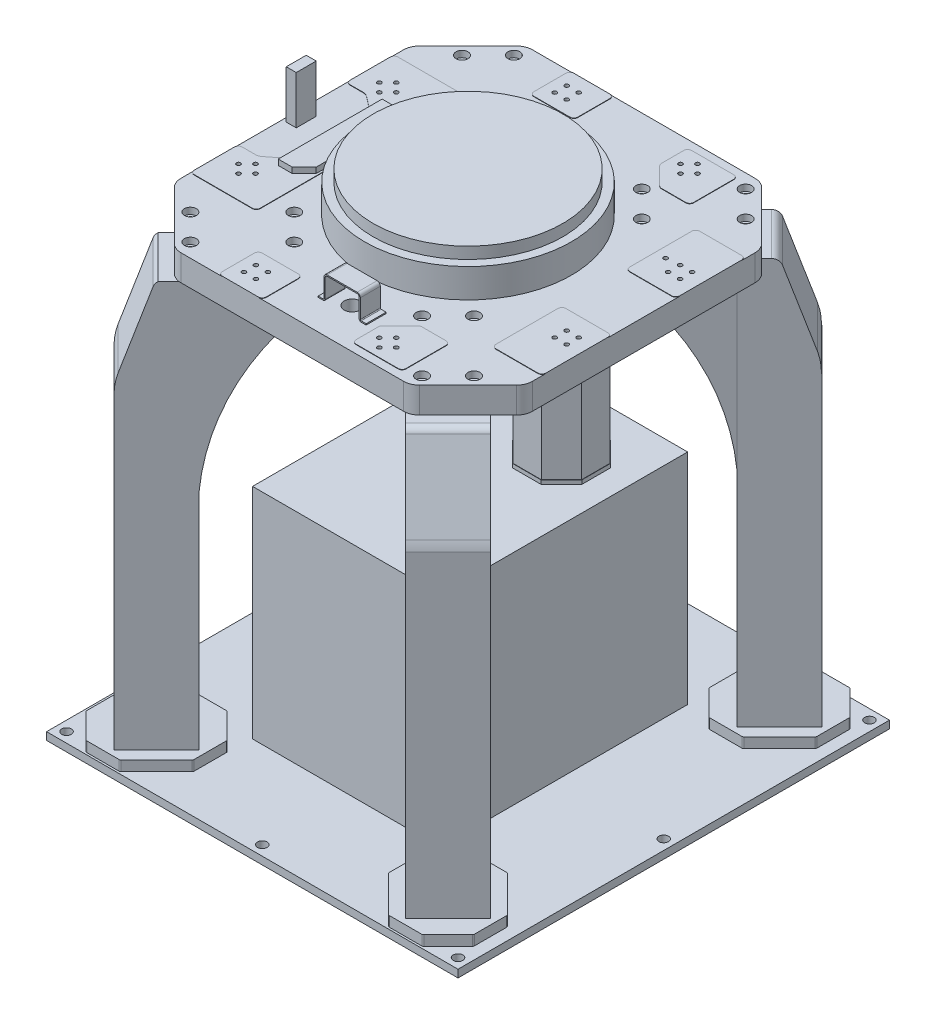
from build123d import *
from OCP.BRepAlgoAPI import BRepAlgoAPI_Cut
from OCP.TopTools import TopTools_ListOfShape

# Parameters (mm, degrees)
SKETCH4_W                                            = 1030
SKETCH4_H                                            = 1080
BASE_EXTRUDE_DEPTH                                   = 19.05
BOSS_EXTRUDE1_DEPTH                                  = 25.4
BOSS_EXTRUDE2_DEPTH                                  = 1016
BOSS_EXTRUDE3_DEPTH                                  = 177.8
BOSS_EXTRUDE3_DEPTH_BACK                             = 76.2
SKETCH9_W                                            = 150.000007
SKETCH9_H                                            = 457.2
BOSS_EXTRUDE4_DEPTH                                  = 177.8
BOSS_EXTRUDE4_DEPTH_BACK                             = 76.2
SKETCH12_W                                           = 150.000007
SKETCH12_H                                           = 457.2
CUT_EXTRUDE1_REACH                                   = 1365.161
CUT_EXTRUDE2_START                                   = -150.000004
CUT_EXTRUDE2_DEPTH                                   = 150.000006
BOSS_EXTRUDE5_DEPTH                                  = 177.8
BOSS_EXTRUDE5_DEPTH_BACK                             = 76.2
SKETCH14_W                                           = 150.000007
SKETCH14_H                                           = 457.2
BOSS_EXTRUDE6_DEPTH                                  = 177.8
BOSS_EXTRUDE6_DEPTH_BACK                             = 76.2
SKETCH15_W                                           = 150.000007
SKETCH15_H                                           = 457.2
CUT_EXTRUDE3_DEPTH                                   = 177.8
CUT_EXTRUDE4_START                                   = -150.000004
CUT_EXTRUDE4_DEPTH                                   = 150.000006
BOSS_EXTRUDE7_DEPTH                                  = 65.024
SKETCH19_W                                           = 469.9
SKETCH19_H                                           = 619.178727
BOSS_EXTRUDE8_DEPTH                                  = 547.624
BOSS_EXTRUDE9_DEPTH                                  = 90.5
BOSS_EXTRUDE10_DEPTH                                 = 239.395
EXTRUDE1_DEPTH                                       = 11.5
BOSS_EXTRUDE11_DEPTH                                 = 9.7155
EXTRUDE2_DEPTH                                       = 9.365
EXTRUDE3_DEPTH                                       = 21.7475
EXTRUDE3_TAPER                                       = 1
SKETCH23_R                                           = 258.980392
BOSS_EXTRUDE12_DEPTH                                 = 72.5
SKETCH24_R                                           = 237.5
BOSS_EXTRUDE13_DEPTH                                 = 29
M24_0_24_000000_DIAMETER_HOLE1_D                     = 24
LPATTERN1_COUNT                                      = 3
LPATTERN1_PITCH                                      = 515
LPATTERN1_COUNT_DIR2                                 = 3
LPATTERN1_PITCH_DIR2                                 = 490
M16_FORO_LAMATO_PER_VITE_A_TESTA_ESAGONA_D           = 17.5
M16_FORO_LAMATO_PER_VITE_A_TESTA_ESAGONA_DEPTH       = 65.024
M16_FORO_LAMATO_PER_VITE_A_TESTA_ESAGONA_CBORE_D     = 30
M16_FORO_LAMATO_PER_VITE_A_TESTA_ESAGONA_CBORE_DEPTH = 16
SCHIZZO10_W                                          = 200
SCHIZZO10_H                                          = 140
ESTRUSIONE1_DEPTH                                    = 170
SCHIZZO11_R                                          = 20
TAGLIO_ESTRUSIONE4_DEPTH                             = 65.024
ESTRUSIONE2_DEPTH                                    = 1
M12_FORO_FILETTATO_PROFONDO1_D                       = 10.2
M12_FORO_FILETTATO_PROFONDO1_DEPTH                   = 66.024
SCHIZZO19_W                                          = 25
SCHIZZO19_H                                          = 50
ESTRUSIONE3_DEPTH                                    = 120
ESTRUSIONE4_DEPTH                                    = 15
ESTRUSIONE4_DEPTH_BACK                               = 5
ESTRUSIONE_SOTTILE1_START                            = -125
ESTRUSIONE_SOTTILE1_DEPTH                            = 50
SCHIZZO23_W                                          = 100
SCHIZZO23_H                                          = 100
ESTRUSIONE5_DEPTH                                    = 10
SMUSSO1_SIZE                                         = 5


with BuildPart() as part:
    # Sketch4 → Base-Extrude (new body)
    with BuildSketch(Plane(origin=(0, 0, 0), x_dir=(1, 0, 0), z_dir=(0, 1, 0))):
        Rectangle(SKETCH4_W, SKETCH4_H)
    extrude(amount=BASE_EXTRUDE_DEPTH)

    # Sketch5 → Boss-Extrude1 (add)
    with BuildSketch(Plane(origin=(0, 19.05, 0), x_dir=(-1, 0, 0), z_dir=(0, 1, 0))):
        with BuildLine():
            Line((335.019684, -533.512103), (246.104734, -444.597152))
            ThreePointArc((246.104734, -444.597152), (245.003528, -442.949082), (244.616836, -441.00505))
            Line((244.616836, -441.00505), (244.61684, -360.360649))
            ThreePointArc((244.61684, -360.360649), (245.003532, -358.416617), (246.104737, -356.768546))
            Line((246.104737, -356.768546), (306.76855, -296.104734))
            ThreePointArc((306.76855, -296.104734), (308.416621, -295.003528), (310.360652, -294.616836))
            Line((310.360652, -294.616836), (391.00506, -294.616836))
            ThreePointArc((391.00506, -294.616836), (392.949091, -295.003528), (394.597163, -296.10473))
            Line((394.597163, -296.10473), (483.512103, -385.019674))
            ThreePointArc((483.512103, -385.019674), (484.613309, -386.667745), (485.000001, -388.611777))
            Line((485.000001, -388.611777), (485.000001, -469.256184))
            ThreePointArc((485.000001, -469.256184), (484.613309, -471.200216), (483.512103, -472.848287))
            Line((483.512103, -472.848287), (422.84829, -533.5121))
            ThreePointArc((422.84829, -533.5121), (421.20022, -534.613305), (419.256188, -534.999997))
            Line((419.256188, -534.999997), (338.611787, -535.000001))
            ThreePointArc((338.611787, -535.000001), (336.667755, -534.613309), (335.019684, -533.512103))
        make_face()
        with BuildLine():
            Line((-244.616836, -441.00505), (-244.61684, -360.360649))
            ThreePointArc((-244.61684, -360.360649), (-245.003532, -358.416617), (-246.104737, -356.768546))
            Line((-246.104737, -356.768546), (-306.76855, -296.104734))
            ThreePointArc((-306.76855, -296.104734), (-308.416621, -295.003528), (-310.360652, -294.616836))
            Line((-310.360652, -294.616836), (-391.00506, -294.616836))
            ThreePointArc((-391.00506, -294.616836), (-392.949091, -295.003528), (-394.597163, -296.10473))
            Line((-394.597163, -296.10473), (-483.512103, -385.019674))
            ThreePointArc((-483.512103, -385.019674), (-484.613309, -386.667745), (-485.000001, -388.611777))
            Line((-485.000001, -388.611777), (-485.000001, -469.256184))
            ThreePointArc((-485.000001, -469.256184), (-484.613309, -471.200216), (-483.512103, -472.848287))
            Line((-483.512103, -472.848287), (-422.84829, -533.5121))
            ThreePointArc((-422.84829, -533.5121), (-421.20022, -534.613305), (-419.256188, -534.999997))
            Line((-419.256188, -534.999997), (-338.611787, -535.000001))
            ThreePointArc((-338.611787, -535.000001), (-336.667755, -534.613309), (-335.019684, -533.512103))
            Line((-335.019684, -533.512103), (-246.104734, -444.597152))
            ThreePointArc((-246.104734, -444.597152), (-245.003528, -442.949082), (-244.616836, -441.00505))
        make_face()
        with BuildLine():
            Line((244.616836, 441.00505), (244.61684, 360.360649))
            ThreePointArc((244.61684, 360.360649), (245.003532, 358.416617), (246.104737, 356.768546))
            Line((246.104737, 356.768546), (306.76855, 296.104734))
            ThreePointArc((306.76855, 296.104734), (308.416621, 295.003528), (310.360652, 294.616836))
            Line((310.360652, 294.616836), (391.00506, 294.616836))
            ThreePointArc((391.00506, 294.616836), (392.949091, 295.003528), (394.597163, 296.10473))
            Line((394.597163, 296.10473), (483.512103, 385.019674))
            ThreePointArc((483.512103, 385.019674), (484.613309, 386.667745), (485.000001, 388.611777))
            Line((485.000001, 388.611777), (485.000001, 469.256184))
            ThreePointArc((485.000001, 469.256184), (484.613309, 471.200216), (483.512103, 472.848287))
            Line((483.512103, 472.848287), (422.84829, 533.5121))
            ThreePointArc((422.84829, 533.5121), (421.20022, 534.613305), (419.256188, 534.999997))
            Line((419.256188, 534.999997), (338.611787, 535.000001))
            ThreePointArc((338.611787, 535.000001), (336.667755, 534.613309), (335.019684, 533.512103))
            Line((335.019684, 533.512103), (246.104734, 444.597152))
            ThreePointArc((246.104734, 444.597152), (245.003528, 442.949082), (244.616836, 441.00505))
        make_face()
        with BuildLine():
            Line((-335.019684, 533.512103), (-246.104734, 444.597152))
            ThreePointArc((-246.104734, 444.597152), (-245.003528, 442.949082), (-244.616836, 441.00505))
            Line((-244.616836, 441.00505), (-244.61684, 360.360649))
            ThreePointArc((-244.61684, 360.360649), (-245.003532, 358.416617), (-246.104737, 356.768546))
            Line((-246.104737, 356.768546), (-306.76855, 296.104734))
            ThreePointArc((-306.76855, 296.104734), (-308.416621, 295.003528), (-310.360652, 294.616836))
            Line((-310.360652, 294.616836), (-391.00506, 294.616836))
            ThreePointArc((-391.00506, 294.616836), (-392.949091, 295.003528), (-394.597163, 296.10473))
            Line((-394.597163, 296.10473), (-483.512103, 385.019674))
            ThreePointArc((-483.512103, 385.019674), (-484.613309, 386.667745), (-485.000001, 388.611777))
            Line((-485.000001, 388.611777), (-485.000001, 469.256184))
            ThreePointArc((-485.000001, 469.256184), (-484.613309, 471.200216), (-483.512103, 472.848287))
            Line((-483.512103, 472.848287), (-422.84829, 533.5121))
            ThreePointArc((-422.84829, 533.5121), (-421.20022, 534.613305), (-419.256188, 534.999997))
            Line((-419.256188, 534.999997), (-338.611787, 535.000001))
            ThreePointArc((-338.611787, 535.000001), (-336.667755, 534.613309), (-335.019684, 533.512103))
        make_face()
    extrude(amount=BOSS_EXTRUDE1_DEPTH)

    # Sketch6 → Boss-Extrude2 (add)
    with BuildSketch(Plane(origin=(0, 44.45, 0), x_dir=(-1, 0, 0), z_dir=(0, 1, 0))):
        Polygon((364.791864, 520.85787), (470.857868, 414.791848), (364.792063, 308.726043), (258.72605, 414.792074), align=None)
        Polygon((258.72605, -414.792074), (364.792063, -308.726043), (470.857868, -414.791848), (364.791864, -520.85787), align=None)
        Polygon((-364.791864, -520.85787), (-470.857868, -414.791848), (-364.792063, -308.726043), (-258.72605, -414.792074), align=None)
        Polygon((-258.72605, 414.792074), (-364.792063, 308.726043), (-470.857868, 414.791848), (-364.791864, 520.85787), align=None)
    extrude(amount=BOSS_EXTRUDE2_DEPTH)

    # Sketch9 → Boss-Extrude3 (add, two sides: drawn at the far end of the back side and taken through both)
    with BuildSketch(Plane(origin=(-336.759084, 0, 336.759027), x_dir=(-0.7071067222412493, 0, -0.707106840131841), z_dir=(0.707106840131841, 0, -0.7071067222412493)).offset(-BOSS_EXTRUDE3_DEPTH_BACK)):
        with Locations((-35.355381, 831.85)):
            Rectangle(SKETCH9_W, SKETCH9_H)
    extrude(amount=BOSS_EXTRUDE3_DEPTH + BOSS_EXTRUDE3_DEPTH_BACK)

    # Sketch12 → Boss-Extrude4 (add, two sides: drawn at the far end of the back side and taken through both)
    with BuildSketch(Plane(origin=(-336.759084, 0, -336.759027), x_dir=(0.7071067222412493, 0, -0.707106840131841), z_dir=(0.707106840131841, 0, 0.7071067222412493)).offset(-BOSS_EXTRUDE4_DEPTH_BACK)):
        with Locations((35.355381, 831.85)):
            Rectangle(SKETCH12_W, SKETCH12_H)
    extrude(amount=BOSS_EXTRUDE4_DEPTH + BOSS_EXTRUDE4_DEPTH_BACK)

    # Sketch11 → Cut-Extrude1 (cut, up to next)
    with BuildSketch(Plane(origin=(78.033034, 0, 78.033047), x_dir=(0.7071068401318419, 0, -0.7071067222412484), z_dir=(0.7071067222412484, 0, 0.7071068401318419)), mode=Mode.PRIVATE) as cut_extrude1_sk1:
        with BuildLine():
            Line((-476.249224, 603.070662), (-476.249224, 537.249112))
            Line((-476.249224, 537.249112), (-191.197117, 537.249112))
            Line((-191.197117, 537.249112), (-191.197117, 1012.381678))
            Line((-191.197117, 1012.381678), (-297.66446, 1012.381678))
            ThreePointArc((-297.66446, 1012.381678), (-299.934967, 994.691688), (-309.233278, 979.472215))
            ThreePointArc((-309.233278, 979.472215), (-425.163771, 805.657877), (-476.249224, 603.070662))
        make_face()
    cut_extrude1_tool1 = extrude(cut_extrude1_sk1.sketch, amount=-CUT_EXTRUDE1_REACH, mode=Mode.PRIVATE) & part.part
    # Sketch11 → Cut-Extrude1 (cut, up to next)
    with BuildSketch(Plane(origin=(78.033034, 0, 78.033047), x_dir=(0.7071068401318419, 0, -0.7071067222412484), z_dir=(0.7071067222412484, 0, 0.7071068401318419)), mode=Mode.PRIVATE) as cut_extrude1_sk2:
        with BuildLine():
            Line((-619.187248, 862.834274), (-557.397589, 1049.461065))
            ThreePointArc((-557.397589, 1049.461065), (-550.244945, 1059.219873), (-538.732571, 1062.942761))
            Line((-538.732571, 1062.942761), (-533.613663, 1077.567942))
            Line((-533.613663, 1077.567942), (-868.111305, 1077.567942))
            Line((-868.111305, 1077.567942), (-868.111305, 812.900685))
            Line((-868.111305, 812.900685), (-626.248924, 812.900685))
            ThreePointArc((-626.248924, 812.900685), (-624.961589, 838.184759), (-619.187248, 862.834274))
        make_face()
    cut_extrude1_tool2 = extrude(cut_extrude1_sk2.sketch, amount=-CUT_EXTRUDE1_REACH, mode=Mode.PRIVATE) & part.part
    add(cut_extrude1_tool1.solids().sort_by_distance((-142.622671, 741.960708, 298.688714))[0], mode=Mode.SUBTRACT)
    add(cut_extrude1_tool2.solids().sort_by_distance((-436.749289, 952.347173, 592.815283))[0], mode=Mode.SUBTRACT)


with BuildPart() as cut_extrude2_tool:
    # Cut-Extrude2: read off the stored shape, not the designer's step
    # Cut-Extrude2 outline → Cut-Extrude2 (new body)
    with BuildSketch(Plane(origin=(-350.833008, 257.130059, -294.766994), x_dir=(0.707106840131841, 0, 0.7071067222412493), z_dir=(-0.7071067222412493, 0, 0.707106840131841)).offset(CUT_EXTRUDE2_START)):
        with BuildLine():
            ThreePointArc((158.058919, 743.784433), (154.085193, 732.782128), (147.274865, 723.271048))
            ThreePointArc((147.274865, 723.271048), (31.344372, 549.456711), (-19.741081, 346.869496))
            Line((-19.741081, 346.869496), (-19.741081, 346.119941))
            Line((-19.741081, 346.119941), (158.058919, 346.119941))
            Line((158.058919, 346.119941), (158.058919, 743.784433))
        make_face()
        with BuildLine():
            ThreePointArc((-100.623705, 793.259899), (-97.660377, 798.913544), (-93.042077, 803.319941))
            Line((-93.042077, 803.319941), (-169.740781, 803.319941))
            Line((-169.740781, 803.319941), (-169.740781, 556.699518))
            Line((-169.740781, 556.699518), (-169.47504, 556.699518))
            ThreePointArc((-169.47504, 556.699518), (-168.187706, 581.983592), (-162.413364, 606.633108))
            Line((-162.413364, 606.633108), (-100.623705, 793.259899))
        make_face()
    extrude(amount=CUT_EXTRUDE2_DEPTH)


with BuildPart() as part_1:
    add(part.part)

    # Cut-Extrude2: cut by cut_extrude2_tool, with a tolerance
    cut_extrude2_stock = TopTools_ListOfShape()
    cut_extrude2_stock.Append(part_1.part.wrapped)
    cut_extrude2_tools = TopTools_ListOfShape()
    cut_extrude2_tools.Append(cut_extrude2_tool.part.wrapped)
    cut_extrude2_cut = BRepAlgoAPI_Cut()
    cut_extrude2_cut.SetArguments(cut_extrude2_stock)
    cut_extrude2_cut.SetTools(cut_extrude2_tools)
    cut_extrude2_cut.SetFuzzyValue(0.00001)
    cut_extrude2_cut.Build()
    add(Compound.cast(cut_extrude2_cut.Shape()).solids(), mode=Mode.REPLACE)

    # Sketch14 → Boss-Extrude5 (add, two sides: drawn at the far end of the back side and taken through both)
    with BuildSketch(Plane(origin=(336.759084, 0, -336.759027), x_dir=(0.7071067222412493, 0, 0.707106840131841), z_dir=(-0.707106840131841, 0, 0.7071067222412493)).offset(-BOSS_EXTRUDE5_DEPTH_BACK)):
        with Locations((-35.355381, 831.85)):
            Rectangle(SKETCH14_W, SKETCH14_H)
    extrude(amount=BOSS_EXTRUDE5_DEPTH + BOSS_EXTRUDE5_DEPTH_BACK)

    # Sketch15 → Boss-Extrude6 (add, two sides: drawn at the far end of the back side and taken through both)
    with BuildSketch(Plane(origin=(336.759084, 0, 336.759027), x_dir=(-0.7071067222412493, 0, 0.707106840131841), z_dir=(-0.707106840131841, 0, -0.7071067222412493)).offset(-BOSS_EXTRUDE6_DEPTH_BACK)):
        with Locations((35.355381, 831.85)):
            Rectangle(SKETCH15_W, SKETCH15_H)
    extrude(amount=BOSS_EXTRUDE6_DEPTH + BOSS_EXTRUDE6_DEPTH_BACK)

    # Sketch16 → Cut-Extrude3 (cut)
    with BuildSketch(Plane(origin=(290.2639, -37.360583, -446.329919), x_dir=(-0.7071068401318419, 0, 0.7071067222412484), z_dir=(-0.7071067222412484, 0, -0.7071068401318419))):
        with BuildLine():
            Line((44.601252, 637.280498), (44.601252, 571.458948))
            Line((44.601252, 571.458948), (329.653358, 571.458948))
            Line((329.653358, 571.458948), (329.653358, 1046.591514))
            Line((329.653358, 1046.591514), (223.186015, 1046.591514))
            ThreePointArc((223.186015, 1046.591514), (220.915509, 1028.901524), (211.617197, 1013.682051))
            ThreePointArc((211.617197, 1013.682051), (95.686704, 839.867714), (44.601252, 637.280498))
        make_face()
        with BuildLine():
            Line((-97.595098, 897.04411), (-35.805438, 1083.670902))
            ThreePointArc((-35.805438, 1083.670902), (-28.303704, 1093.905996), (-16.229459, 1097.810583))
            Line((-16.229459, 1097.810583), (-12.021512, 1111.777778))
            Line((-12.021512, 1111.777778), (-346.519155, 1111.777778))
            Line((-346.519155, 1111.777778), (-346.519155, 847.110521))
            Line((-346.519155, 847.110521), (-104.656773, 847.110521))
            ThreePointArc((-104.656773, 847.110521), (-103.369439, 872.394595), (-97.595098, 897.04411))
        make_face()
    extrude(amount=-CUT_EXTRUDE3_DEPTH, mode=Mode.SUBTRACT)


with BuildPart() as cut_extrude4_tool:
    # Cut-Extrude4: read off the stored shape, not the designer's step
    # Cut-Extrude4 outline → Cut-Extrude4 (new body)
    with BuildSketch(Plane(origin=(465.843925, 286.86694, 409.777892), x_dir=(-0.707106840131841, 0, -0.7071067222412493), z_dir=(0.7071067222412493, 0, -0.707106840131841)).offset(CUT_EXTRUDE4_START)):
        with BuildLine():
            ThreePointArc((320.708904, 710.890575), (316.735179, 699.88827), (309.92485, 690.37719))
            ThreePointArc((309.92485, 690.37719), (194.431183, 517.664095), (142.908904, 316.38306))
            Line((142.908904, 316.38306), (320.708904, 316.38306))
            Line((320.708904, 316.38306), (320.708904, 710.890575))
        make_face()
        with BuildLine():
            ThreePointArc((60.048556, 760.366041), (65.932382, 769.126622), (75.498331, 773.58306))
            Line((75.498331, 773.58306), (-7.090796, 773.58306))
            Line((-7.090796, 773.58306), (-7.090796, 551.889944))
            ThreePointArc((-7.090796, 551.889944), (-4.851015, 562.92112), (-1.741103, 573.739249))
            Line((-1.741103, 573.739249), (60.048556, 760.366041))
        make_face()
    extrude(amount=CUT_EXTRUDE4_DEPTH)


with BuildPart() as part_2:
    add(part_1.part)

    # Cut-Extrude4: cut by cut_extrude4_tool, with a tolerance
    cut_extrude4_stock = TopTools_ListOfShape()
    cut_extrude4_stock.Append(part_2.part.wrapped)
    cut_extrude4_tools = TopTools_ListOfShape()
    cut_extrude4_tools.Append(cut_extrude4_tool.part.wrapped)
    cut_extrude4_cut = BRepAlgoAPI_Cut()
    cut_extrude4_cut.SetArguments(cut_extrude4_stock)
    cut_extrude4_cut.SetTools(cut_extrude4_tools)
    cut_extrude4_cut.SetFuzzyValue(0.00001)
    cut_extrude4_cut.Build()
    add(Compound.cast(cut_extrude4_cut.Shape()).solids(), mode=Mode.REPLACE)

    # Sketch18 → Boss-Extrude7 (add)
    with BuildSketch(Plane(origin=(0, 1060.45, 0), x_dir=(-1, 0, 0), z_dir=(0, 1, 0))):
        with BuildLine():
            Line((278.5, -440.000001), (-278.5, -440.000001))
            ThreePointArc((-278.5, -440.000001), (-293.807337, -436.955182), (-306.784271, -428.284272))
            Line((-306.784271, -428.284272), (-428.284271, -306.784272))
            ThreePointArc((-428.284271, -306.784272), (-436.955181, -293.807338), (-440, -278.500001))
            Line((-440, -278.500001), (-440, 278.500001))
            ThreePointArc((-440, 278.500001), (-436.955181, 293.807338), (-428.284271, 306.784272))
            Line((-428.284271, 306.784272), (-306.784271, 428.284272))
            ThreePointArc((-306.784271, 428.284272), (-293.807337, 436.955182), (-278.5, 440.000001))
            Line((-278.5, 440.000001), (278.5, 440.000001))
            ThreePointArc((278.5, 440.000001), (293.807338, 436.955182), (306.784272, 428.284271))
            Line((306.784272, 428.284271), (428.284272, 306.784267))
            ThreePointArc((428.284272, 306.784267), (436.955181, 293.807333), (440, 278.499996))
            Line((440, 278.499996), (440, -278.500001))
            ThreePointArc((440, -278.500001), (436.955181, -293.807338), (428.284271, -306.784272))
            Line((428.284271, -306.784272), (306.784271, -428.284272))
            ThreePointArc((306.784271, -428.284272), (293.807337, -436.955182), (278.5, -440.000001))
        make_face()
    extrude(amount=BOSS_EXTRUDE7_DEPTH)

    # Sketch19 → Boss-Extrude8 (add)
    with BuildSketch(Plane(origin=(0, 19.05, 0), x_dir=(-1, 0, 0), z_dir=(0, 1, 0))):
        with Locations((6.35, -11.583793)):
            Rectangle(SKETCH19_W, SKETCH19_H)
    extrude(amount=BOSS_EXTRUDE8_DEPTH)

    # Sketch20 → Boss-Extrude9 (add)
    with BuildSketch(Plane.XZ.offset(-1060.45)):
        with BuildLine():
            Line((225.820725, 87), (312, 87))
            ThreePointArc((312, 87), (319.071068, 84.071068), (322, 77))
            Line((322, 77), (322, -77))
            ThreePointArc((322, -77), (319.071068, -84.071068), (312, -87))
            Line((312, -87), (225.820725, -87))
            ThreePointArc((225.820725, -87), (-242, 0), (225.820725, 87))
        make_face()
    extrude(amount=BOSS_EXTRUDE9_DEPTH)

    # Sketch21 → Boss-Extrude10 (add)
    with BuildSketch(Plane.XZ.offset(-969.95)):
        Polygon((198.377634, -86), (269.622366, -86), (320, -35.622366), (320, 35.622366), (269.622366, 86), (198.377634, 86), (148, 35.622366), (148, -35.622366), align=None)
    extrude(amount=BOSS_EXTRUDE10_DEPTH)

    # Sketch28 → Extrude1 (add)
    with BuildSketch(Plane.XZ.offset(-969.95)):
        with BuildLine():
            Line((305, -86), (163, -86))
            ThreePointArc((163, -86), (152.393398, -81.606602), (148, -71))
            Line((148, -71), (148, 71))
            ThreePointArc((148, 71), (152.393398, 81.606602), (163, 86))
            Line((163, 86), (305, 86))
            ThreePointArc((305, 86), (315.606602, 81.606602), (320, 71))
            Line((320, 71), (320, -71))
            ThreePointArc((320, -71), (315.606602, -81.606602), (305, -86))
        make_face()
    extrude(amount=EXTRUDE1_DEPTH)

    # Sketch22 → Boss-Extrude11 (add)
    with BuildSketch(Plane.XZ.offset(-730.555)):
        Polygon((147.238, -35.937997), (198.062003, -86.762), (269.937997, -86.762), (320.762, -35.937997), (320.762, 35.937997), (269.937997, 86.762), (198.062003, 86.762), (147.238, 35.937997), align=None)
    extrude(amount=BOSS_EXTRUDE11_DEPTH)

    # Sketch29 → Extrude2 (add)
    with BuildSketch(Plane.XZ.offset(-720.8395)):
        with BuildLine():
            Line((208.500039, -45), (259.499961, -45))
            ThreePointArc((259.499961, -45), (262.328388, -43.828427), (263.499961, -41))
            Line((263.499961, -41), (263.499961, -35.100004))
            ThreePointArc((263.499961, -35.100004), (265.140163, -31.140206), (269.099961, -29.500004))
            Line((269.099961, -29.500004), (275, -29.500004))
            ThreePointArc((275, -29.500004), (277.828427, -28.328431), (279, -25.500004))
            Line((279, -25.500004), (279, 25.499996))
            ThreePointArc((279, 25.499996), (277.828427, 28.328423), (275, 29.499996))
            Line((275, 29.499996), (269.099986, 29.499996))
            ThreePointArc((269.099986, 29.499996), (265.140188, 31.140198), (263.499986, 35.099996))
            Line((263.499986, 35.099996), (263.499986, 41))
            ThreePointArc((263.499986, 41), (262.328404, 43.828436), (259.499961, 45))
            Line((259.499961, 45), (208.500039, 45))
            ThreePointArc((208.500039, 45), (205.671612, 43.828427), (204.500039, 41))
            Line((204.500039, 41), (204.500039, 35.099996))
            ThreePointArc((204.500039, 35.099996), (202.859837, 31.140198), (198.900039, 29.499996))
            Line((198.900039, 29.499996), (193, 29.499996))
            ThreePointArc((193, 29.499996), (190.171573, 28.328423), (189, 25.499996))
            Line((189, 25.499996), (189, -25.500004))
            ThreePointArc((189, -25.500004), (190.171573, -28.328431), (193, -29.500004))
            Line((193, -29.500004), (198.900039, -29.500004))
            ThreePointArc((198.900039, -29.500004), (202.859837, -31.140206), (204.500039, -35.100004))
            Line((204.500039, -35.100004), (204.500039, -41))
            ThreePointArc((204.500039, -41), (205.671612, -43.828427), (208.500039, -45))
        make_face()
    extrude(amount=EXTRUDE2_DEPTH)

    # Sketch30 → Extrude3 (add)
    with BuildSketch(Plane.XZ.offset(-711.4745)):
        with BuildLine():
            Line((222.949495, -38.150004), (245.050505, -38.150004))
            ThreePointArc((245.050505, -38.150004), (247.729289, -37.617161), (250.000253, -36.099752))
            Line((250.000253, -36.099752), (266.35, -19.750004))
            Line((266.35, -19.750004), (273.35, -19.750004))
            Line((273.35, -19.750004), (273.35, 19.749996))
            Line((273.35, 19.749996), (266.35, 19.749996))
            Line((266.35, 19.749996), (250.000253, 36.099743))
            ThreePointArc((250.000253, 36.099743), (247.729289, 37.617153), (245.050505, 38.149996))
            Line((245.050505, 38.149996), (222.949495, 38.149996))
            ThreePointArc((222.949495, 38.149996), (220.270711, 37.617153), (217.999747, 36.099743))
            Line((217.999747, 36.099743), (197.900253, 16.000248))
            ThreePointArc((197.900253, 16.000248), (196.382843, 13.729285), (195.85, 11.050501))
            Line((195.85, 11.050501), (195.85, -11.050509))
            ThreePointArc((195.85, -11.050509), (196.382843, -13.729293), (197.900253, -16.000257))
            Line((197.900253, -16.000257), (217.999747, -36.099752))
            ThreePointArc((217.999747, -36.099752), (220.270711, -37.617161), (222.949495, -38.150004))
        make_face()
    extrude(amount=EXTRUDE3_DEPTH, taper=EXTRUDE3_TAPER)

    # Sketch23 → Boss-Extrude12 (add)
    with BuildSketch(Plane(origin=(0, 1125.474, 0), x_dir=(-1, 0, 0), z_dir=(0, 1, 0))):
        with Locations(Location((0, 0, 0), (0, 0, 90))):
            Circle(SKETCH23_R)
    extrude(amount=BOSS_EXTRUDE12_DEPTH)

    # Sketch24 → Boss-Extrude13 (add)
    with BuildSketch(Plane(origin=(0, 1197.974, 0), x_dir=(-1, 0, 0), z_dir=(0, 1, 0))):
        with Locations(Location((0, 0, 0), (0, 0, 90))):
            Circle(SKETCH24_R)
    extrude(amount=BOSS_EXTRUDE13_DEPTH)

    # M24.0 (24.000000) Diameter Hole1 (through all)
    with Locations(Plane(origin=(0, 19.05, 0), x_dir=(-1, 0, 0), z_dir=(0, 1, 0))):
        with Locations((-490, 515)):
            m24_0_24_000000_diameter_hole1 = Hole(M24_0_24_000000_DIAMETER_HOLE1_D / 2)

    # LPattern1: M24.0 _24.000000_ Diameter Hole1 3 × 3, 1 skipped
    with Locations(*[(-j * LPATTERN1_PITCH_DIR2, 0, -i * LPATTERN1_PITCH) for i in range(LPATTERN1_COUNT) for j in range(LPATTERN1_COUNT_DIR2) if (i, j) not in ((0, 0), (1, 1))]):
        add(m24_0_24_000000_diameter_hole1, mode=Mode.SUBTRACT)

    # M16 Foro lamato per vite a testa esagonale (parzialmente filettata)1
    with Locations(Plane(origin=(0, 1125.474, 0), x_dir=(-1, 0, 0), z_dir=(0, 1, 0))):
        with Locations((290, -405), (355, -340), (-290, -405), (-355, -340), (-355, 340), (-290, 405), (290, 405), (355, 340), (-225, 210), (-160, 275), (160, 275), (225, 210), (-225, -210), (-160, -275), (160, -275), (225, -210)):
            CounterBoreHole(M16_FORO_LAMATO_PER_VITE_A_TESTA_ESAGONA_D / 2, M16_FORO_LAMATO_PER_VITE_A_TESTA_ESAGONA_CBORE_D / 2, M16_FORO_LAMATO_PER_VITE_A_TESTA_ESAGONA_CBORE_DEPTH, depth=M16_FORO_LAMATO_PER_VITE_A_TESTA_ESAGONA_DEPTH)

    # Schizzo10 → Estrusione1 (add)
    with BuildSketch(Plane.XZ.offset(-1060.45)):
        with Locations((-350, -100)):
            Rectangle(SCHIZZO10_W, SCHIZZO10_H)
    extrude(amount=ESTRUSIONE1_DEPTH)

    # Schizzo11 → Taglio-Estrusione4 (cut)
    with BuildSketch(Plane(origin=(0, 1125.474, 0), x_dir=(-1, 0, 0), z_dir=(0, 1, 0))):
        with Locations(Location((-50, 340.000001, 0), (0, 0, 90))):
            Circle(SCHIZZO11_R)
    extrude(amount=-TAGLIO_ESTRUSIONE4_DEPTH, mode=Mode.SUBTRACT)

    # Schizzo13 → Estrusione2 (add)
    with BuildSketch(Plane(origin=(0, 1125.474, 0), x_dir=(-1, 0, 0), z_dir=(0, 1, 0))):
        with BuildLine():
            Line((185, -430), (185, -350))
            ThreePointArc((185, -350), (182.071068, -342.928932), (175, -340))
            Line((175, -340), (85, -340))
            ThreePointArc((85, -340), (77.928932, -342.928932), (75, -350))
            Line((75, -350), (75, -430))
            ThreePointArc((75, -430), (77.928932, -437.071068), (85, -440))
            Line((85, -440), (175, -440))
            ThreePointArc((175, -440), (182.071068, -437.071068), (185, -430))
        make_face()
        with BuildLine():
            Line((-177.071068, -302.928932), (-132.928932, -347.071068))
            ThreePointArc((-132.928932, -347.071068), (-130.761205, -350.315301), (-130, -354.142136))
            Line((-130, -354.142136), (-130, -410))
            ThreePointArc((-130, -410), (-132.928932, -417.071068), (-140, -420))
            Line((-140, -420), (-245, -420))
            ThreePointArc((-245, -420), (-252.071068, -417.071068), (-255, -410))
            Line((-255, -410), (-255, -310))
            ThreePointArc((-255, -310), (-252.071068, -302.928932), (-245, -300))
            Line((-245, -300), (-184.142136, -300))
            ThreePointArc((-184.142136, -300), (-180.315301, -300.761205), (-177.071068, -302.928932))
        make_face()
        with BuildLine():
            Line((-325, -255), (-430, -255))
            ThreePointArc((-430, -255), (-437.071068, -252.071068), (-440, -245))
            Line((-440, -245), (-440, -90))
            ThreePointArc((-440, -90), (-437.071068, -82.928932), (-430, -80))
            Line((-430, -80), (-325, -80))
            ThreePointArc((-325, -80), (-317.928932, -82.928932), (-315, -90))
            Line((-315, -90), (-315, -245))
            ThreePointArc((-315, -245), (-317.928932, -252.071068), (-325, -255))
        make_face()
        with BuildLine():
            Line((-315, 245), (-315, 90))
            ThreePointArc((-315, 90), (-317.928932, 82.928932), (-325, 80))
            Line((-325, 80), (-430, 80))
            ThreePointArc((-430, 80), (-437.071068, 82.928932), (-440, 90))
            Line((-440, 90), (-440, 245))
            ThreePointArc((-440, 245), (-437.071068, 252.071068), (-430, 255))
            Line((-430, 255), (-325, 255))
            ThreePointArc((-325, 255), (-317.928932, 252.071068), (-315, 245))
        make_face()
        with BuildLine():
            Line((-184.142126, 300), (-245, 300))
            ThreePointArc((-245, 300), (-252.071068, 302.928932), (-255, 310))
            Line((-255, 310), (-255, 410))
            ThreePointArc((-255, 410), (-252.071068, 417.071068), (-245, 420))
            Line((-245, 420), (-140, 420))
            ThreePointArc((-140, 420), (-132.928932, 417.071068), (-130, 410))
            Line((-130, 410), (-130, 354.142126))
            ThreePointArc((-130, 354.142126), (-130.761205, 350.315291), (-132.928932, 347.071058))
            Line((-132.928932, 347.071058), (-177.071058, 302.928932))
            ThreePointArc((-177.071058, 302.928932), (-180.315291, 300.761205), (-184.142126, 300))
        make_face()
        with BuildLine():
            Line((175, 340), (85, 340))
            ThreePointArc((85, 340), (77.928932, 342.928932), (75, 350))
            Line((75, 350), (75, 430))
            ThreePointArc((75, 430), (77.928932, 437.071068), (85, 440))
            Line((85, 440), (175, 440))
            ThreePointArc((175, 440), (182.071068, 437.071068), (185, 430))
            Line((185, 430), (185, 350))
            ThreePointArc((185, 350), (182.071068, 342.928932), (175, 340))
        make_face()
        with BuildLine():
            Line((430, 255), (285, 255))
            ThreePointArc((285, 255), (277.928932, 252.071068), (275, 245))
            Line((275, 245), (275, 65.24723))
            ThreePointArc((275, 65.24723), (280.627788, 56.25369), (291.176752, 57.382897))
            Line((291.176752, 57.382897), (384.561675, 130.728666))
            ThreePointArc((384.561675, 130.728666), (390.379635, 133.902028), (396.91518, 135))
            Line((396.91518, 135), (430, 135))
            ThreePointArc((430, 135), (437.071068, 137.928932), (440, 145))
            Line((440, 145), (440, 245))
            ThreePointArc((440, 245), (437.071068, 252.071068), (430, 255))
        make_face()
        with BuildLine():
            Line((275, -65.24724), (275, -245))
            ThreePointArc((275, -245), (277.928932, -252.071068), (285, -255))
            Line((285, -255), (430, -255))
            ThreePointArc((430, -255), (437.071068, -252.071068), (440, -245))
            Line((440, -245), (440, -145))
            ThreePointArc((440, -145), (437.071068, -137.928932), (430, -135))
            Line((430, -135), (396.91518, -135))
            ThreePointArc((396.91518, -135), (390.379636, -133.902028), (384.561676, -130.728667))
            Line((384.561676, -130.728667), (291.176752, -57.382907))
            ThreePointArc((291.176752, -57.382907), (280.627788, -56.2537), (275, -65.24724))
        make_face()
    extrude(amount=ESTRUSIONE2_DEPTH)

    # M12 Foro filettato profondo1
    with Locations(Plane(origin=(0, 1126.474, 0), x_dir=(-1, 0, 0), z_dir=(0, 1, 0))):
        with Locations((-340.673427, -153.927482), (-404, -157), (-374, -157), (-374, -127), (-404, -127), (-404, 127), (-404, 157), (-374, 157), (-374, 127), (-197.4264, 377), (-176.2132, 398.2132), (-155, 377), (-176.2132, 355.78679), (127, 374), (127, 404), (157, 404), (157, 374), (355.7868, 176.2132), (377, 197.4264), (398.21321, 176.2132), (377, 155), (355.7868, -176.21321), (377, -155), (398.21321, -176.21321), (377, -197.42641), (127, -374), (127, -404), (157, -404), (157, -374), (-176.2132, -398.21321), (-197.4264, -377), (-176.2132, -355.7868), (-155, -377)):
            Hole(M12_FORO_FILETTATO_PROFONDO1_D / 2, depth=M12_FORO_FILETTATO_PROFONDO1_DEPTH)

    # Schizzo19 → Estrusione3 (add)
    with BuildSketch(Plane(origin=(0, 1125.474, 0), x_dir=(-1, 0, 0), z_dir=(0, 1, 0))):
        with Locations((417.5, 0)):
            Rectangle(SCHIZZO19_W, SCHIZZO19_H)
    extrude(amount=ESTRUSIONE3_DEPTH)

    # Schizzo20 → Estrusione4 (add, two sides: drawn at the far end of the back side and taken through both)
    with BuildSketch(Plane(origin=(0, 1125.474, 0), x_dir=(-1, 0, 0), z_dir=(0, 1, 0)).offset(-ESTRUSIONE4_DEPTH_BACK)):
        Polygon((310, -130), (345, -130), (345, 130), (310, 130), (280, 100), (280, -100), align=None)
    extrude(amount=ESTRUSIONE4_DEPTH + ESTRUSIONE4_DEPTH_BACK)

    # Schizzo22 → Estrusione-Sottile1 (add)
    with BuildSketch(Plane.XY.offset(440.000001).offset(ESTRUSIONE_SOTTILE1_START)):
        with BuildLine():
            Line((-10, 1125.474), (2.5, 1125.474))
            ThreePointArc((2.5, 1125.474), (6.035534, 1126.938466), (7.5, 1130.474))
            Line((7.5, 1130.474), (7.5, 1177.474))
            ThreePointArc((7.5, 1177.474), (8.964466, 1181.009534), (12.5, 1182.474))
            Line((12.5, 1182.474), (87.5, 1182.474))
            ThreePointArc((87.5, 1182.474), (91.035534, 1181.009534), (92.5, 1177.474))
            Line((92.5, 1177.474), (92.5, 1130.474))
            ThreePointArc((92.5, 1130.474), (93.964466, 1126.938466), (97.5, 1125.474))
            Line((97.5, 1125.474), (110, 1125.474))
            Line((110, 1125.474), (110, 1128.474))
            Line((110, 1128.474), (97.5, 1128.474))
            ThreePointArc((97.5, 1128.474), (96.085786, 1129.059786), (95.5, 1130.474))
            Line((95.5, 1130.474), (95.5, 1177.474))
            ThreePointArc((95.5, 1177.474), (93.156854, 1183.130854), (87.5, 1185.474))
            Line((87.5, 1185.474), (12.5, 1185.474))
            ThreePointArc((12.5, 1185.474), (6.843146, 1183.130854), (4.5, 1177.474))
            Line((4.5, 1177.474), (4.5, 1130.474))
            ThreePointArc((4.5, 1130.474), (3.914214, 1129.059786), (2.5, 1128.474))
            Line((2.5, 1128.474), (-10, 1128.474))
            Line((-10, 1128.474), (-10, 1125.474))
        make_face()
    extrude(amount=ESTRUSIONE_SOTTILE1_DEPTH)

    # Schizzo23 → Estrusione5 (add)
    with BuildSketch(Plane.ZY.offset(450)):
        with Locations((-100, 975.45)):
            Rectangle(SCHIZZO23_W, SCHIZZO23_H)
    extrude(amount=ESTRUSIONE5_DEPTH)

    # Smusso1
    smusso1_edges = [part_2.edges().sort_by_distance(p)[0] for p in [
        (-460, 975.45, -150),
        (-460, 925.45, -100),
        (-460, 975.45, -50),
        (-460, 1025.45, -100),
    ]]
    chamfer(smusso1_edges, length=SMUSSO1_SIZE)


solid = part_2.part
